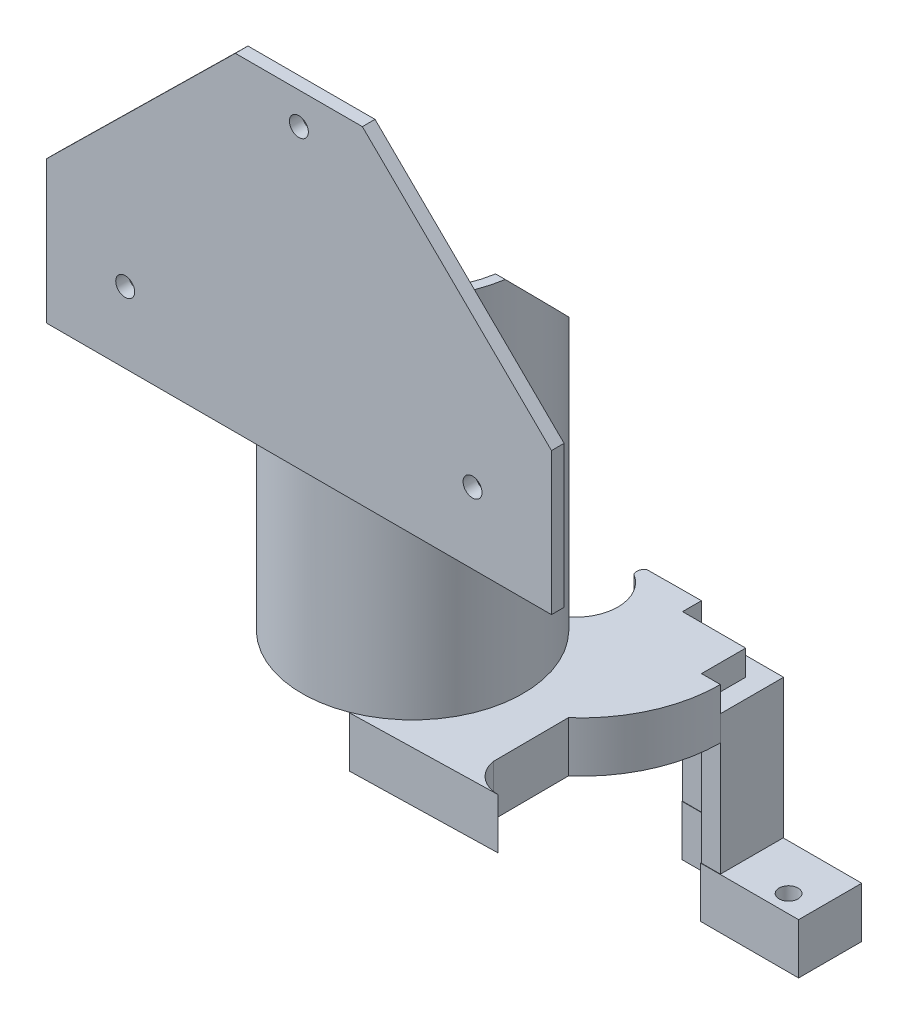
from build123d import *

# Parameters (mm, degrees)
BOSS_EXTRUDE1_DEPTH      = 53
BOSS_EXTRUDE1_DEPTH_BACK = 5
SKETCH1_R                = 17.5
SKETCH2_R                = 16
CUT_EXTRUDE1_DEPTH       = 108
SKETCH3_W                = 25
SKETCH3_H                = 20
CUT_EXTRUDE2_DEPTH       = 108
CUT_EXTRUDE3_DEPTH       = 108
CUT_EXTRUDE3_DEPTH_BACK  = 108
BOSS_EXTRUDE2_DEPTH      = 2
SKETCH10_R               = 1.5
CUT_EXTRUDE4_DEPTH       = 16
BOSS_EXTRUDE3_DEPTH      = 8
BOSS_EXTRUDE5_DEPTH      = 18
BOSS_EXTRUDE5_DEPTH_BACK = 4
SKETCH13_R               = 1.500172947
BOSS_EXTRUDE6_DEPTH      = 8


with BuildPart() as part:
    # Sketch1 → Boss-Extrude1 (new, two sides: drawn at the far end of the back side and taken through both)
    with BuildSketch(Plane(origin=(0, 0, 0), x_dir=(1, 0, 0), z_dir=(0, 1, 0)).offset(-BOSS_EXTRUDE1_DEPTH_BACK)):
        Circle(SKETCH1_R)
    extrude(amount=BOSS_EXTRUDE1_DEPTH + BOSS_EXTRUDE1_DEPTH_BACK)

    # Sketch2 → Cut-Extrude1 (cut)
    with BuildSketch(Plane(origin=(0, 53, 0), x_dir=(1, 0, 0), z_dir=(0, 1, 0))):
        Circle(SKETCH2_R)
    extrude(amount=-CUT_EXTRUDE1_DEPTH, mode=Mode.SUBTRACT)

    # Sketch3 → Cut-Extrude2 (cut)
    with BuildSketch(Plane(origin=(0, 53, 0), x_dir=(1, 0, 0), z_dir=(0, 1, 0))):
        with Locations((0, 16)):
            Rectangle(SKETCH3_W, SKETCH3_H)
    extrude(amount=-CUT_EXTRUDE2_DEPTH, mode=Mode.SUBTRACT)

    # Sketch7 → Cut-Extrude3 (cut, two sides: drawn at the far end of the back side and taken through both)
    with BuildSketch(Plane(origin=(0, 0, 0), x_dir=(0, 0, -1), z_dir=(1, 0, 0)).offset(-CUT_EXTRUDE3_DEPTH_BACK)):
        Polygon((12.247448714, 53), (12.247448714, 38), (-2.626275643, 53), align=None)
    extrude(amount=CUT_EXTRUDE3_DEPTH + CUT_EXTRUDE3_DEPTH_BACK, mode=Mode.SUBTRACT)

    # Sketch8 → Boss-Extrude2 (add)
    with BuildSketch(Plane.XY.offset(18)):
        Polygon((10.05709572, 78.023156751), (40, 48.571119754), (40, 26.071119754), (0, 26.071119754), (-40, 26.071119754), (-40, 48.571119754), (-10.05709572, 78.023156751), align=None)
    extrude(amount=-BOSS_EXTRUDE2_DEPTH)

    # Sketch10 → Cut-Extrude4 (cut)
    with BuildSketch(Plane(origin=(0, 0, 16), x_dir=(-1, 0, 0), z_dir=(0, 0, -1))):
        with Locations((-27.5, 37.321119754)):
            Circle(SKETCH10_R)
        with Locations((27.5, 37.321119754)):
            Circle(SKETCH10_R)
        with Locations((0, 73)):
            Circle(SKETCH10_R)
    extrude(amount=-CUT_EXTRUDE4_DEPTH, mode=Mode.SUBTRACT)

    # Sketch11 → Boss-Extrude3 (add)
    with BuildSketch(Plane.XZ.offset(5)):
        with BuildLine():
            Line((10.275891909, -26.805431868), (18.890882144, -26.863380934))
            Line((18.890882144, -26.863380934), (18.890882144, -23.863377119))
            Line((18.890882144, -23.863377119), (28.890882144, -23.863377119))
            Line((28.890882144, -23.863377119), (28.890882144, -16.863377119))
            Line((28.890882144, -16.863377119), (31.890882144, -16.863377119))
            ThreePointArc((31.890882144, -16.863377119), (29.928759086, -7.76088478), (24.390882144, -0.275084044))
            Line((24.390882144, -0.275084044), (24.452405581, 11.618795847))
            ThreePointArc((24.452405581, 11.618795847), (26.143620347, 14.638664645), (29.390882144, 15.836623644))
            Line((29.390882144, 15.836623644), (6.375618396, 16.386397999))
            Line((6.375618396, 16.386397999), (6.012446141, 1.182878311))
            Line((6.012446141, 1.182878311), (6.390882144, -8.863379027))
            Line((6.390882144, -8.863379027), (6.480237612, -11.760990645))
            ThreePointArc((6.480237612, -11.760990645), (7.33967567, -12.860163004), (8.724622378, -13.029680754))
            ThreePointArc((8.724622378, -13.029680754), (13.107641391, -18.70255332), (9.931897769, -25.129604841))
            ThreePointArc((9.931897769, -25.129604841), (9.756819698, -26.038761874), (10.275891909, -26.805431868))
        make_face()
    extrude(amount=BOSS_EXTRUDE3_DEPTH)


with BuildPart() as body_2:
    # Sketch12 → Boss-Extrude5 (new, two sides: drawn at the far end of the back side and taken through both)
    with BuildSketch(Plane.XZ.offset(13).offset(-BOSS_EXTRUDE5_DEPTH_BACK)):
        Polygon((18.890882144, -26.863380934), (18.890882144, -23.863377119), (28.890882144, -23.863377119), (28.890882144, -16.863377119), (31.890882144, -16.863377119), (31.890882144, -26.863380934), align=None)
    extrude(amount=BOSS_EXTRUDE5_DEPTH + BOSS_EXTRUDE5_DEPTH_BACK)

    # Sketch13 → Boss-Extrude6 (add)
    with BuildSketch(Plane.XZ.offset(31)):
        Polygon((18.822698898, -26.807587047), (18.822698898, -23.807583233), (28.822698898, -23.807583233), (28.822698898, -16.807583233), (44.322698898, -16.807583233), (44.322698898, -26.807587047), align=None)
        with Locations((39.936045011, -19.607691517)):
            Circle(SKETCH13_R, mode=Mode.SUBTRACT)
    extrude(amount=BOSS_EXTRUDE6_DEPTH)


solid = Compound([part.part, body_2.part])
